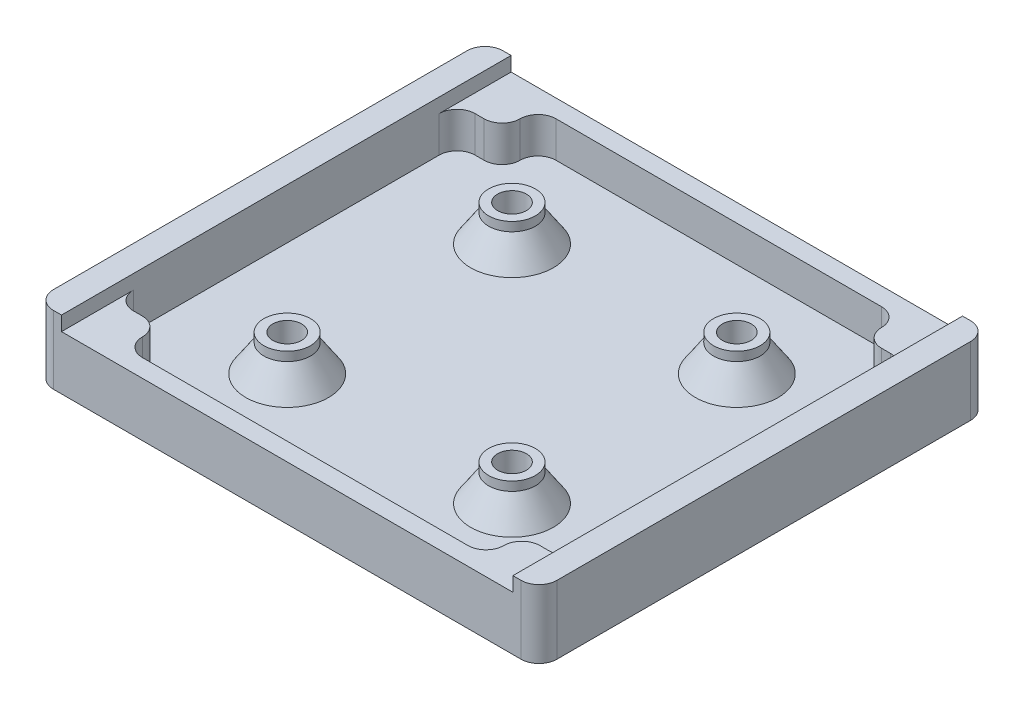
from build123d import *

# Parameters (mm, degrees)
SKETCH_1_W               = 56
SKETCH_1_H               = 50
SKETCH_1_R               = 1.6
EXTRUDE_1_DEPTH          = 7.6
CUT_EXTRUDE_START        = -1.6
SKETCH_2_W               = 50.2
SKETCH_2_H               = 50
SKETCH_2_R               = 1.6
CUT_EXTRUDE_1_DEPTH      = 1.6
CUT_EXTRUDE_START_2      = -4
SKETCH_3_W               = 40.2
SKETCH_3_H               = 38
SKETCH_3_R               = 1.6
SKETCH_3_H_2             = 6
SKETCH_3_W_2             = 5
CUT_EXTRUDE_2_DEPTH      = 4
SKETCH_4_R               = 2.6
SKETCH_4_R_2             = 1.6
EXTRUDE_2_DEPTH          = 4
SKETCH_6_W               = 40.2
SKETCH_6_H               = 2
EXTRUDE_3_DEPTH          = 4
FILLET_2_R               = 2
SKETCH_7_R               = 2.8
CUT_EXTRUDE_3_DEPTH      = 3.2
PATTERN_CIRCULAR_2_COUNT = 4


with BuildPart() as part:
    # 草图1 → 凸台-拉伸1 (new body)
    with BuildSketch(Plane(origin=(0, 0, 0), x_dir=(1, 0, 0), z_dir=(0, 1, 0))):
        Rectangle(SKETCH_1_W, SKETCH_1_H)
        with Locations(Location((-12.5, 12.5, 0), (0, 0, 90))):
            Circle(SKETCH_1_R, mode=Mode.SUBTRACT)
        with Locations(Location((12.5, 12.5, 0), (0, 0, 90))):
            Circle(SKETCH_1_R, mode=Mode.SUBTRACT)
        with Locations(Location((12.5, -12.5, 0), (0, 0, 90))):
            Circle(SKETCH_1_R, mode=Mode.SUBTRACT)
        with Locations(Location((-12.5, -12.5, 0), (0, 0, 90))):
            Circle(SKETCH_1_R, mode=Mode.SUBTRACT)
    extrude(amount=EXTRUDE_1_DEPTH)

    # 草图2 → 切除-拉伸1 (cut)
    with BuildSketch(Plane(origin=(0, 7.6, 0), x_dir=(1, 0, 0), z_dir=(0, 1, 0)).offset(CUT_EXTRUDE_START)):
        Rectangle(SKETCH_2_W, SKETCH_2_H)
        with Locations(Location((-12.5, -12.5, 0), (0, 0, 90))):
            Circle(SKETCH_2_R, mode=Mode.SUBTRACT)
        with Locations(Location((12.5, -12.5, 0), (0, 0, 90))):
            Circle(SKETCH_2_R, mode=Mode.SUBTRACT)
        with Locations(Location((-12.5, 12.5, 0), (0, 0, 90))):
            Circle(SKETCH_2_R, mode=Mode.SUBTRACT)
        with Locations(Location((12.5, 12.5, 0), (0, 0, 90))):
            Circle(SKETCH_2_R, mode=Mode.SUBTRACT)
    extrude(amount=CUT_EXTRUDE_1_DEPTH, mode=Mode.SUBTRACT)

    # 草图3 → 切除-拉伸2 (cut)
    # profile 1 of 5: a face of its own
    with BuildSketch(Plane(origin=(0, 6, 0), x_dir=(1, 0, 0), z_dir=(0, 1, 0)).offset(CUT_EXTRUDE_START_2)):
        Rectangle(SKETCH_3_W, SKETCH_3_H)
        with Locations(Location((-12.5, -12.5, 0), (0, 0, 90))):
            Circle(SKETCH_3_R, mode=Mode.SUBTRACT)
        with Locations(Location((12.5, -12.5, 0), (0, 0, 90))):
            Circle(SKETCH_3_R, mode=Mode.SUBTRACT)
        with Locations(Location((-12.5, 12.5, 0), (0, 0, 90))):
            Circle(SKETCH_3_R, mode=Mode.SUBTRACT)
        with Locations(Location((12.5, 12.5, 0), (0, 0, 90))):
            Circle(SKETCH_3_R, mode=Mode.SUBTRACT)
    # profile 2 of 5: a face of its own
    with BuildSketch(Plane(origin=(0, 6, 0), x_dir=(1, 0, 0), z_dir=(0, 1, 0)).offset(CUT_EXTRUDE_START_2)):
        with Locations((0, 22)):
            Rectangle(SKETCH_3_W, SKETCH_3_H_2)
    # profile 3 of 5: a face of its own
    with BuildSketch(Plane(origin=(0, 6, 0), x_dir=(1, 0, 0), z_dir=(0, 1, 0)).offset(CUT_EXTRUDE_START_2)):
        with Locations((22.6, 0)):
            Rectangle(SKETCH_3_W_2, SKETCH_3_H)
    # profile 4 of 5: a face of its own
    with BuildSketch(Plane(origin=(0, 6, 0), x_dir=(1, 0, 0), z_dir=(0, 1, 0)).offset(CUT_EXTRUDE_START_2)):
        with Locations((-22.6, 0)):
            Rectangle(SKETCH_3_W_2, SKETCH_3_H)
    # profile 5 of 5: a face of its own
    with BuildSketch(Plane(origin=(0, 6, 0), x_dir=(1, 0, 0), z_dir=(0, 1, 0)).offset(CUT_EXTRUDE_START_2)):
        with Locations((0, -22)):
            Rectangle(SKETCH_3_W, SKETCH_3_H_2)
    extrude(amount=CUT_EXTRUDE_2_DEPTH, mode=Mode.SUBTRACT)

    # 草图4 → 凸台-拉伸2 (add)
    # profile 1 of 4: a face of its own
    with BuildSketch(Plane(origin=(0, 2, 0), x_dir=(1, 0, 0), z_dir=(0, 1, 0))):
        with Locations(Location((-12.5, 12.5, 0), (0, 0, 270))):
            Circle(SKETCH_4_R)
        with Locations(Location((-12.5, 12.5, 0), (0, 0, 90))):
            Circle(SKETCH_4_R_2, mode=Mode.SUBTRACT)
    # profile 2 of 4: a face of its own
    with BuildSketch(Plane(origin=(0, 2, 0), x_dir=(1, 0, 0), z_dir=(0, 1, 0))):
        with Locations(Location((12.5, 12.5, 0), (0, 0, 270))):
            Circle(SKETCH_4_R)
        with Locations(Location((12.5, 12.5, 0), (0, 0, 90))):
            Circle(SKETCH_4_R_2, mode=Mode.SUBTRACT)
    # profile 3 of 4: a face of its own
    with BuildSketch(Plane(origin=(0, 2, 0), x_dir=(1, 0, 0), z_dir=(0, 1, 0))):
        with Locations(Location((12.5, -12.5, 0), (0, 0, 270))):
            Circle(SKETCH_4_R)
        with Locations(Location((12.5, -12.5, 0), (0, 0, 90))):
            Circle(SKETCH_4_R_2, mode=Mode.SUBTRACT)
    # profile 4 of 4: a face of its own
    with BuildSketch(Plane(origin=(0, 2, 0), x_dir=(1, 0, 0), z_dir=(0, 1, 0))):
        with Locations(Location((-12.5, -12.5, 0), (0, 0, 270))):
            Circle(SKETCH_4_R)
        with Locations(Location((-12.5, -12.5, 0), (0, 0, 90))):
            Circle(SKETCH_4_R_2, mode=Mode.SUBTRACT)
    extrude(amount=EXTRUDE_2_DEPTH)

    # 草图6 → 凸台-拉伸3 (add)
    with BuildSketch(Plane(origin=(0, 2, 0), x_dir=(1, 0, 0), z_dir=(0, 1, 0))):
        with Locations((0, -24)):
            Rectangle(SKETCH_6_W, SKETCH_6_H)
        with Locations((0, 24)):
            Rectangle(SKETCH_6_W, SKETCH_6_H)
    extrude(amount=EXTRUDE_3_DEPTH)

    # 圆角2
    fillet_2_edges = [part.edges().sort_by_distance(p)[0] for p in [
        (25.1, 4, 19),
        (20.1, 4, 19),
        (20.1, 4, 23),
        (-28, 3.8, -25),
        (-28, 3.8, 25),
        (28, 3.8, 25),
        (28, 3.8, -25),
        (-20.1, 4, 23),
        (-25.1, 4, 19),
        (-20.1, 4, 19),
        (25.1, 4, -19),
        (20.1, 4, -19),
        (20.1, 4, -23),
        (-20.1, 4, -23),
        (-20.1, 4, -19),
        (-25.1, 4, -19),
    ]]
    fillet(fillet_2_edges, radius=FILLET_2_R - 0.0001)  # a hair under: the kernel refuses the full size

    # 草图5 → 旋转1 (revolve)
    with BuildSketch(Plane.XY.offset(12.5), mode=Mode.PRIVATE) as revolve_1_sk:
        Polygon((-9.9, 5), (-7.9, 2), (-9.9, 2), align=None)
    revolve_1 = revolve(revolve_1_sk.sketch.rotate(Axis((-12.5, 6, 12.5), (0, -1, 0)), 270), axis=Axis((-12.5, 6, 12.5), (0, -1, 0)))

    # 草图7 → 切除-拉伸3 (cut)
    with BuildSketch(Plane.XZ):
        with Locations(Location((-12.5, 12.5, 0), (0, 0, 270))):
            Circle(SKETCH_7_R)
    cut_extrude_3 = extrude(amount=-CUT_EXTRUDE_3_DEPTH, mode=Mode.SUBTRACT)

    # 阵列(圆周)2: 旋转1, 切除-拉伸3 ×4 about axis
    pattern_circular_2_axis = Axis((0, 0, 0), (0, 1, 0))
    add([revolve_1.rotate(pattern_circular_2_axis, i * 360 / PATTERN_CIRCULAR_2_COUNT) for i in range(1, PATTERN_CIRCULAR_2_COUNT)])
    add([cut_extrude_3.rotate(pattern_circular_2_axis, i * 360 / PATTERN_CIRCULAR_2_COUNT) for i in range(1, PATTERN_CIRCULAR_2_COUNT)], mode=Mode.SUBTRACT)


solid = part.part
